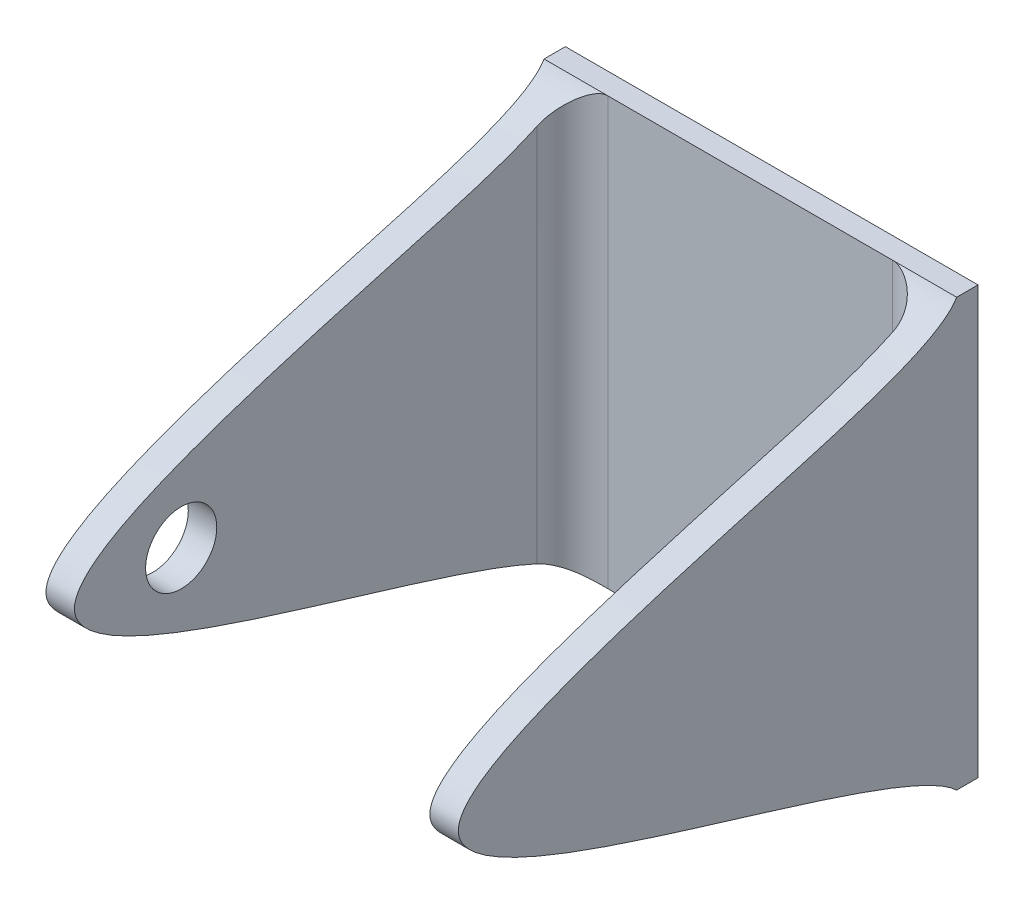
from build123d import *

# Parameters (mm, degrees)
BOSS_EXTRUDE1_DEPTH = 4
BOSS_EXTRUDE2_DEPTH = 4
SKETCH7_W           = 60
SKETCH7_H           = 58
BOSS_EXTRUDE3_DEPTH = 3
FILLET2_START       = -30.000000115
FILLET2_DEPTH       = 60.000000115
FILLET2_2_DEPTH     = 50
FILLET2_START_2     = 44.9999999
FILLET2_3_DEPTH     = 5.0000001
SKETCH2_4_R         = 5
CUT_EXTRUDE1_DEPTH  = 5


with BuildPart() as part:
    # Sketch6 → Boss-Extrude1 (new body)
    with BuildSketch(Plane.YZ.offset(50)):
        with BuildLine():
            Line((-30, -28), (30, -28))
            add(Edge.make_bspline(
                [(-30, -28), (-21.341162822, -18.933637736), (-4.314034272, 78.522274038), (17.303381943, 5.877471269), (25.855908326, -25.643416869), (30, -28)],
                knots=[0, 0, 0, 0, 0.428019727, 0.687018033, 0.856039454, 0.856039454, 0.856039454, 0.856039454], degree=3))
        make_face()
    extrude(amount=BOSS_EXTRUDE1_DEPTH)



with BuildPart() as body_2:
    # Sketch2 → Boss-Extrude2 (new body)
    with BuildSketch(Plane.YZ):
        with BuildLine():
            Line((-30, -28), (30, -28))
            add(Edge.make_bspline(
                [(-30, -28), (-21.357866352, -18.89790242), (-4.588676367, 78.427600294), (17.792657751, 5.890750685), (25.855908326, -25.643416869), (30, -28)],
                knots=[0, 0, 0, 0, 0.428019727, 0.687018033, 0.856039454, 0.856039454, 0.856039454, 0.856039454], degree=3))
        make_face()
    extrude(amount=-BOSS_EXTRUDE2_DEPTH)


with BuildPart() as part_1:
    add(part.part)

    add(body_2.part)  # Boss-Extrude3 merges body 2
    # Sketch7 → Boss-Extrude3 (add)
    with BuildSketch(Plane.YX.offset(28)):
        with Locations((0, 25)):
            Rectangle(SKETCH7_W, SKETCH7_H)
    extrude(amount=BOSS_EXTRUDE3_DEPTH)

    # Fillet2: read off the stored shape, not the designer's step
    # Fillet2 outline → Fillet2 (add)
    with BuildSketch(Plane(origin=(0, 0, 0), x_dir=(1, 0, 0), z_dir=(0, 1, 0)).offset(FILLET2_START)):
        with BuildLine():
            Line((50, 28), (45, 28))
            ThreePointArc((45, 28), (48.535533906, 26.535533906), (50, 23))
            Line((50, 23), (50, 28))
        make_face()
        with BuildLine():
            ThreePointArc((0, 23), (1.464466094, 26.535533906), (5, 28))
            Line((5, 28), (0, 28))
            Line((0, 28), (0, 23))
        make_face()
    extrude(amount=FILLET2_DEPTH)

    # Fillet2 2 outline → Fillet2 2 (cut)
    with BuildSketch(Plane.YZ):
        with BuildLine():
            Line((-26.955658307, -23), (-30.000000115, -23))
            Line((-30.000000115, -23), (-30, -28))
            add(Edge.make_bspline(
                [(-30, -28), (-29.008314276, -26.955533367), (-27.992857706, -25.232504786), (-26.955658307, -23)],
                knots=[0, 0, 0, 0, 0.049115308, 0.049115308, 0.049115308, 0.049115308], degree=3))
        make_face()
        with BuildLine():
            add(Edge.make_bspline(
                [(26.295963783, -23), (27.464737595, -25.485053142), (28.683961451, -27.251620261), (30, -28)],
                knots=[0.802363347, 0.802363347, 0.802363347, 0.802363347, 0.856039454, 0.856039454, 0.856039454, 0.856039454], degree=3))
            Line((30, -28), (30, -23))
            Line((30, -23), (26.295963783, -23))
        make_face()
    extrude(amount=FILLET2_2_DEPTH, mode=Mode.SUBTRACT)

    # Fillet2 3 outline → Fillet2 3 (cut)
    with BuildSketch(Plane.YZ.offset(FILLET2_START_2)):
        with BuildLine():
            add(Edge.make_bspline(
                [(-30, -28), (-29.008314276, -26.955533367), (-27.992857706, -25.232504786), (-26.955658307, -23)],
                knots=[0, 0, 0, 0, 0.049115308, 0.049115308, 0.049115308, 0.049115308], degree=3))
            add(Edge.make_bspline(
                [(-30, -28), (-29.005212581, -26.958393265), (-27.984696993, -25.23506108), (-26.941219534, -23)],
                knots=[0, 0, 0, 0, 0.049173882, 0.049173882, 0.049173882, 0.049173882], degree=3))
            Line((-26.941219534, -23), (-26.955658307, -23))
        make_face()
        with BuildLine():
            Line((26.295963783, -23), (26.247524945, -23))
            add(Edge.make_bspline(
                [(26.247524945, -23), (27.444892295, -25.485068916), (28.683770288, -27.251511554), (30, -28)],
                knots=[0.802355551, 0.802355551, 0.802355551, 0.802355551, 0.856039454, 0.856039454, 0.856039454, 0.856039454], degree=3))
            add(Edge.make_bspline(
                [(26.295963783, -23), (27.464737595, -25.485053142), (28.683961451, -27.251620261), (30, -28)],
                knots=[0.802363347, 0.802363347, 0.802363347, 0.802363347, 0.856039454, 0.856039454, 0.856039454, 0.856039454], degree=3))
        make_face()
    extrude(amount=FILLET2_3_DEPTH, mode=Mode.SUBTRACT)

    # Sketch2<4> → Cut-Extrude1 (cut)
    with BuildSketch(Plane.YZ):
        with Locations(Location((-1.9074e-05, 27, 0), (0, 0, 270))):
            Circle(SKETCH2_4_R)
    extrude(amount=-CUT_EXTRUDE1_DEPTH, mode=Mode.SUBTRACT)


solid = part_1.part
